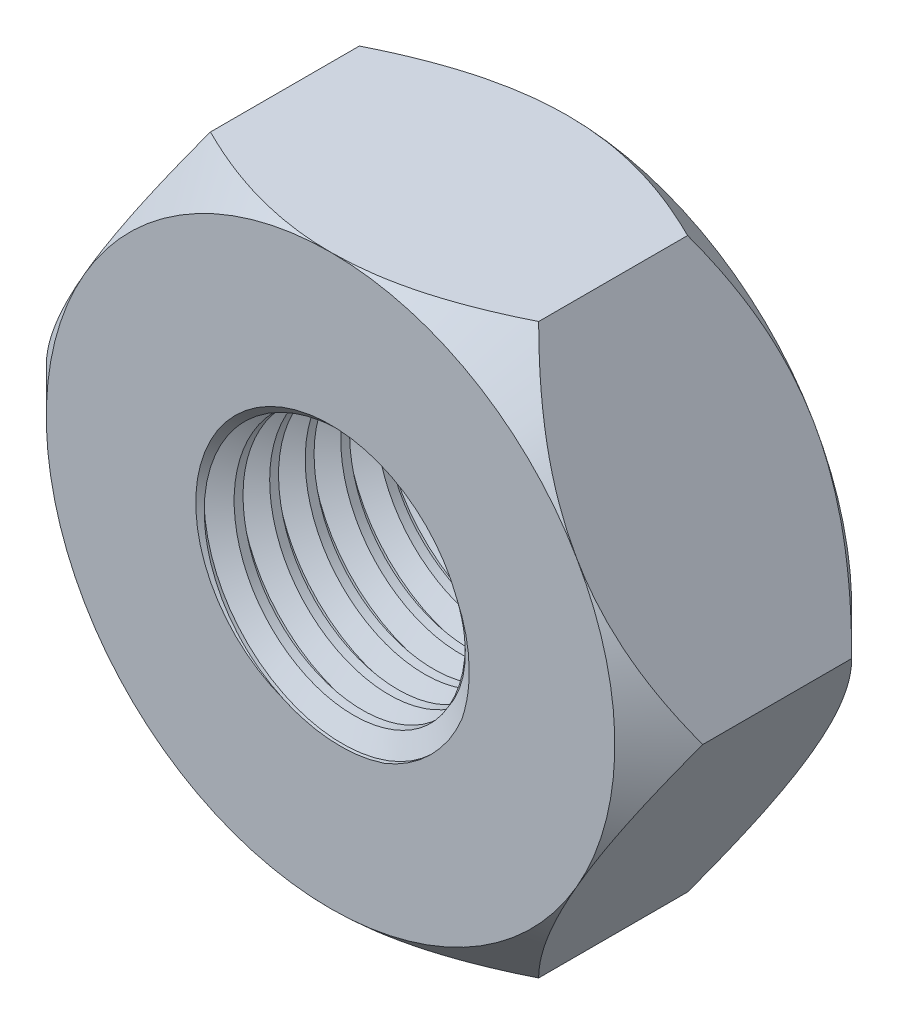
from build123d import *

# Parameters (mm, degrees)
BOSS_EXTRUDE1_DEPTH     = 5
SKETCH2_OUTSIDE_W       = 57.312
SKETCH2_OUTSIDE_H       = 53.6
SKETCH2_OUTSIDE_R       = 12
CUT_EXTRUDE1_DEPTH      = 10
CUT_EXTRUDE1_DRAFT      = -45
MIRROR1_COPY_1_SKETCH_W = 57.312
MIRROR1_COPY_1_SKETCH_H = 53.6
MIRROR1_COPY_1_SKETCH_R = 12
MIRROR1_COPY_1_DEPTH    = 10
MIRROR1_COPY_1_DRAFT    = -45
SKETCH3_R               = 5.19
CUT_EXTRUDE2_DEPTH      = 21.880613018
CHAMFER2_SIZE           = 0.5
THREAD3_PITCH           = 1.5


with BuildPart() as part:
    # Sketch1 → Boss-Extrude1 (new, symmetric)
    with BuildSketch(Plane.XY):
        Polygon((13.856406461, 0), (6.92820323, 12), (-6.92820323, 12), (-13.856406461, 0), (-6.92820323, -12), (6.92820323, -12), align=None)
    extrude(amount=BOSS_EXTRUDE1_DEPTH, both=True)


with BuildPart() as cut_extrude1_tool:
    # Sketch2 outside → Cut-Extrude1 (with draft: the straight prism first)
    with BuildSketch(Plane.XY.offset(5)):
        Rectangle(SKETCH2_OUTSIDE_W, SKETCH2_OUTSIDE_H)
        Circle(SKETCH2_OUTSIDE_R, mode=Mode.SUBTRACT)
    extrude(amount=-CUT_EXTRUDE1_DEPTH)
    # Cut-Extrude1: the draft: its side faces are tilted about the plane it starts from
    cut_extrude1_sides = [cut_extrude1_tool.faces().sort_by_distance(p)[0] for p in [
        (0, -26.8, 0),
        (28.656, 0, 0),
        (0, 26.8, 0),
        (-28.656, 0, 0),
        (-12, 0, 0),
    ]]
    draft(cut_extrude1_sides, Plane.XY.offset(5), CUT_EXTRUDE1_DRAFT)


with BuildPart() as part_1:
    add(part.part)

    # Cut-Extrude1: cut by cut_extrude1_tool
    add(cut_extrude1_tool.part, mode=Mode.SUBTRACT)


with BuildPart() as mirror1_copy_1_tool:
    # Mirror1 copy 1 sketch → Mirror1 copy 1 (with draft: the straight prism first)
    with BuildSketch(Plane(origin=(0, 0, -5), x_dir=(1, 0, 0), z_dir=(0, 0, -1))):
        Rectangle(MIRROR1_COPY_1_SKETCH_W, MIRROR1_COPY_1_SKETCH_H)
        Circle(MIRROR1_COPY_1_SKETCH_R, mode=Mode.SUBTRACT)
    extrude(amount=-MIRROR1_COPY_1_DEPTH)
    # Mirror1 copy 1: the draft: its side faces are tilted about the plane it starts from
    mirror1_copy_1_sides = [mirror1_copy_1_tool.faces().sort_by_distance(p)[0] for p in [
        (0, -26.8, 0),
        (28.656, 0, 0),
        (0, 26.8, 0),
        (-28.656, 0, 0),
        (-12, 0, 0),
    ]]
    draft(mirror1_copy_1_sides, Plane(origin=(0, 0, -5), x_dir=(1, 0, 0), z_dir=(0, 0, -1)), MIRROR1_COPY_1_DRAFT)


with BuildPart() as part_2:
    add(part_1.part)

    # Mirror1 copy 1: cut by mirror1_copy_1_tool
    add(mirror1_copy_1_tool.part, mode=Mode.SUBTRACT)

    # Sketch3 → Cut-Extrude2 (cut, through all)
    with BuildSketch(Plane.XY.offset(5)):
        Circle(SKETCH3_R)
    extrude(amount=-CUT_EXTRUDE2_DEPTH, mode=Mode.SUBTRACT)

    # Chamfer2
    chamfer2_edges = [part_2.edges().sort_by_distance(p)[0] for p in [
        (-5.19, 0, -5),
        (-5.19, 0, 5),
    ]]
    chamfer(chamfer2_edges, length=CHAMFER2_SIZE)

    # Thread3: the profile of Thread Profile3 profile screwed along a right-hand helix of 9.666667 turns, 8 arcs to a turn; built about Z, then put on its axis
    thread3_z = Axis((0, 0, 0), (0, 0, 1))
    thread3_corners = [(5.1897, 0, -0.000173205), (6.001898813, 0, 0.468749998), (6.001898813, 0, 0.656249998), (5.1897, 0, 1.125173201)]
    with BuildLine(mode=Mode.PRIVATE) as thread3_profile:
        Line(thread3_corners[0], thread3_corners[1])
        Line(thread3_corners[1], thread3_corners[2])
        Line(thread3_corners[2], thread3_corners[3])
        Line(thread3_corners[3], thread3_corners[0])
    thread3_cap = Face(thread3_profile.wire())
    thread3_turn_angles = [0, 22.5, 45, 67.5, 90, 112.5, 135, 157.5, 180, 202.5, 225, 247.5, 270, 292.5, 315, 337.5, 360]
    thread3_turn_weights = [1, 0.9238795325112867, 1, 0.9238795325112867, 1, 0.9238795325112867, 1, 0.9238795325112867, 1, 0.9238795325112867, 1, 0.9238795325112867, 1, 0.9238795325112867, 1, 0.9238795325112867, 1]
    thread3_turn_rails = [Edge.make_bspline([Vector(p[0], p[1], 0).rotate(thread3_z, thread3_turn_angles[k]) / thread3_turn_weights[k] + Vector(0, 0, p[2] + THREAD3_PITCH * thread3_turn_angles[k] / 360) for k in range(17)], [0, 0, 0, 1, 1, 2, 2, 3, 3, 4, 4, 5, 5, 6, 6, 7, 7, 8, 8, 8], 2, thread3_turn_weights) for p in thread3_corners]
    thread3_turn_sides = [Face.make_surface_from_curves(thread3_turn_rails[p[0]], thread3_turn_rails[p[1]]) for p in [(0, 1), (1, 2), (2, 3), (3, 0)]]
    thread3_last_angles = [3240, 3262.5, 3285, 3307.5, 3330, 3352.5, 3375, 3397.5, 3420, 3442.5, 3465, 3472.5, 3480]
    thread3_last_weights = [1, 0.9238795325112867, 1, 0.9238795325112867, 1, 0.9238795325112867, 1, 0.9238795325112867, 1, 0.9238795325112867, 1, 0.9914448613738125, 1]
    thread3_last_rails = [Edge.make_bspline([Vector(p[0], p[1], 0).rotate(thread3_z, thread3_last_angles[k]) / thread3_last_weights[k] + Vector(0, 0, p[2] + THREAD3_PITCH * thread3_last_angles[k] / 360) for k in range(13)], [0, 0, 0, 1, 1, 2, 2, 3, 3, 4, 4, 5, 5, 6, 6, 6], 2, thread3_last_weights) for p in thread3_corners]
    thread3_last_sides = [Face.make_surface_from_curves(thread3_last_rails[p[0]], thread3_last_rails[p[1]]) for p in [(0, 1), (1, 2), (2, 3), (3, 0)]]
    thread3 = Plane(origin=(0, 0, 9.5), x_dir=(-1, 0, 0), z_dir=(0, 0, -1)) * Solid(Shell([*[p.moved(Location((0, 0, THREAD3_PITCH * i))) for i in range(9) for p in thread3_turn_sides], *thread3_last_sides, thread3_cap, thread3_cap.rotate(thread3_z, 3480).moved(Location((0, 0, THREAD3_PITCH * 3480 / 360)))]))
    add(thread3, mode=Mode.SUBTRACT)


solid = part_2.part
